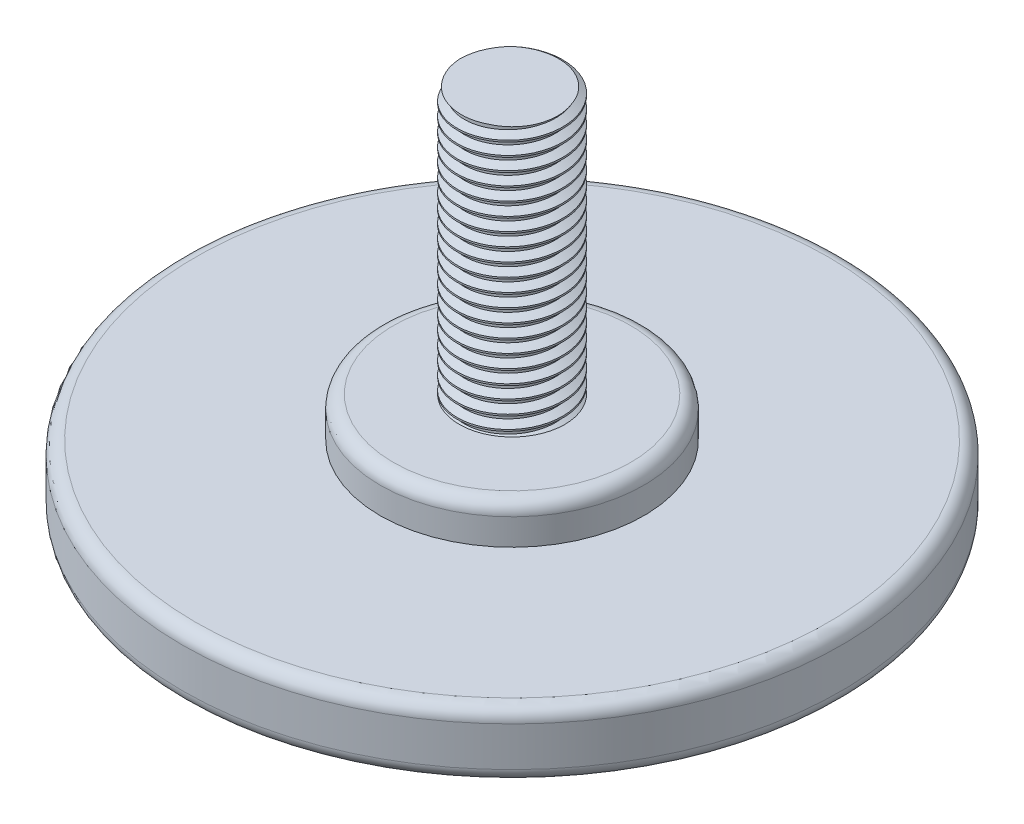
from build123d import *

# Parameters (mm, degrees)
CROQUIS1_R              = 25
SALIENTE_EXTRUIR1_DEPTH = 2.5
CROQUIS2_R              = 10
SALIENTE_EXTRUIR2_DEPTH = 3
CROQUIS3_R              = 4
SALIENTE_EXTRUIR3_DEPTH = 20
ROSCA1_PITCH            = 1
REDONDEO2_R             = 1


with BuildPart() as part:
    # Croquis1 → Saliente-Extruir1 (new, symmetric)
    with BuildSketch(Plane(origin=(0, 0, 0), x_dir=(1, 0, 0), z_dir=(0, 1, 0))):
        with Locations(Location((0, 0, 0), (0, 0, 270))):
            Circle(CROQUIS1_R)
    extrude(amount=SALIENTE_EXTRUIR1_DEPTH, both=True)

    # Croquis2 → Saliente-Extruir2 (add)
    with BuildSketch(Plane(origin=(0, 2.5, 0), x_dir=(1, 0, 0), z_dir=(0, 1, 0))):
        with Locations(Location((0, 0, 0), (0, 0, 270))):
            Circle(CROQUIS2_R)
    extrude(amount=SALIENTE_EXTRUIR2_DEPTH)

    # Croquis3 → Saliente-Extruir3 (add)
    with BuildSketch(Plane(origin=(0, 5.5, 0), x_dir=(1, 0, 0), z_dir=(0, 1, 0))):
        with Locations(Location((0, 0, 0), (0, 0, 270))):
            Circle(CROQUIS3_R)
    extrude(amount=SALIENTE_EXTRUIR3_DEPTH)

    # Rosca1: the profile of Perfil de rosca1 profile screwed along a right-hand helix of 21 turns, 8 arcs to a turn; built about Z, then put on its axis
    rosca1_z = Axis((0, 0, 0), (0, 0, 1))
    rosca1_corners = [(4.0003, 0, -0.000173205), (4.0003, 0, 0.875173202), (3.458734125, 0, 0.562499999), (3.458734125, 0, 0.312499999)]
    with BuildLine(mode=Mode.PRIVATE) as rosca1_profile:
        Line(rosca1_corners[0], rosca1_corners[1])
        Line(rosca1_corners[1], rosca1_corners[2])
        Line(rosca1_corners[2], rosca1_corners[3])
        Line(rosca1_corners[3], rosca1_corners[0])
    rosca1_cap = Face(rosca1_profile.wire())
    rosca1_turn_angles = [0, 22.5, 45, 67.5, 90, 112.5, 135, 157.5, 180, 202.5, 225, 247.5, 270, 292.5, 315, 337.5, 360]
    rosca1_turn_weights = [1, 0.9238795325112867, 1, 0.9238795325112867, 1, 0.9238795325112867, 1, 0.9238795325112867, 1, 0.9238795325112867, 1, 0.9238795325112867, 1, 0.9238795325112867, 1, 0.9238795325112867, 1]
    rosca1_turn_rails = [Edge.make_bspline([Vector(p[0], p[1], 0).rotate(rosca1_z, rosca1_turn_angles[k]) / rosca1_turn_weights[k] + Vector(0, 0, p[2] + ROSCA1_PITCH * rosca1_turn_angles[k] / 360) for k in range(17)], [0, 0, 0, 1, 1, 2, 2, 3, 3, 4, 4, 5, 5, 6, 6, 7, 7, 8, 8, 8], 2, rosca1_turn_weights) for p in rosca1_corners]
    rosca1_turn_sides = [Face.make_surface_from_curves(rosca1_turn_rails[p[0]], rosca1_turn_rails[p[1]]) for p in [(0, 1), (1, 2), (2, 3), (3, 0)]]
    rosca1 = Plane(origin=(0, 26.5, 0), x_dir=(-1, 0, 0), z_dir=(0, -1, 0)) * Solid(Shell([*[p.moved(Location((0, 0, ROSCA1_PITCH * i))) for i in range(21) for p in rosca1_turn_sides], rosca1_cap, rosca1_cap.rotate(rosca1_z, 7560).moved(Location((0, 0, ROSCA1_PITCH * 7560 / 360)))]))
    add(rosca1, mode=Mode.SUBTRACT)

    # Redondeo2
    redondeo2_edges = [part.edges().sort_by_distance(p)[0] for p in [
        (0, -2.5, -25),
        (0, 2.5, -25),
        (0, 5.5, -10),
    ]]
    fillet(redondeo2_edges, radius=REDONDEO2_R)


solid = part.part
